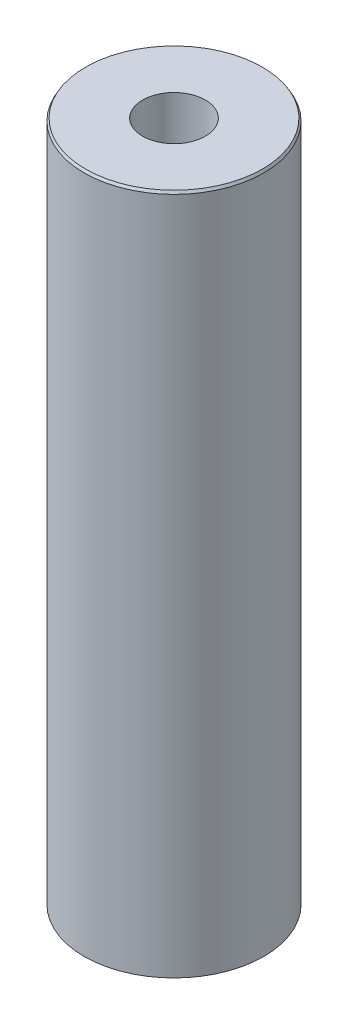
from build123d import *
from OCP.BRepFilletAPI import BRepFilletAPI_MakeChamfer

# Parameters (mm, degrees)
SKETCH1_R           = 37.5
BOSS_EXTRUDE1_DEPTH = 284.88567016
SKETCH2_R           = 13.094735242
CUT_EXTRUDE1_DEPTH  = 290.779821696
CHAMFER1_SIZE       = 1.064138526
CHAMFER1_SIZE2      = 0.614380665


with BuildPart() as part:
    # Sketch1 → Boss-Extrude1 (new body)
    with BuildSketch(Plane(origin=(0, 0, 0), x_dir=(1, 0, 0), z_dir=(0, 1, 0))):
        Circle(SKETCH1_R)
    extrude(amount=BOSS_EXTRUDE1_DEPTH)

    # Sketch2 → Cut-Extrude1 (cut, through all)
    with BuildSketch(Plane(origin=(0, 0, 0), x_dir=(1, 0, 0), z_dir=(0, 1, 0))):
        Circle(SKETCH2_R)
    extrude(amount=CUT_EXTRUDE1_DEPTH, mode=Mode.SUBTRACT)

    # Chamfer1: one chamfer whose edges measure the first distance from different faces: ONE call of the kernel's chamfer builder (chamfer() names one face for all edges)
    chamfer1_edges_1 = [part.edges().sort_by_distance(p)[0] for p in [
        (-37.5, 284.88567016, 0),
    ]]
    chamfer1_side_1 = [part.faces().sort_by_distance(p)[0] for p in [
        (-37.5, 142.44283508, 0),
    ]]
    chamfer1_edges_2 = [part.edges().sort_by_distance(p)[0] for p in [
        (-37.5, 0, 0),
    ]]
    chamfer1_side_2 = [part.faces().sort_by_distance(p)[0] for p in [
        (-36.439339828, 0, 0),
    ]]
    chamfer1 = BRepFilletAPI_MakeChamfer(part.part.solid().wrapped)
    for e in chamfer1_edges_1:
        chamfer1.Add(CHAMFER1_SIZE, CHAMFER1_SIZE2, e.wrapped, chamfer1_side_1[0].wrapped)  # the first distance lies on this face
    for e in chamfer1_edges_2:
        chamfer1.Add(CHAMFER1_SIZE, CHAMFER1_SIZE2, e.wrapped, chamfer1_side_2[0].wrapped)  # the first distance lies on this face
    add(Compound.cast(chamfer1.Shape()), mode=Mode.REPLACE)


solid = part.part
